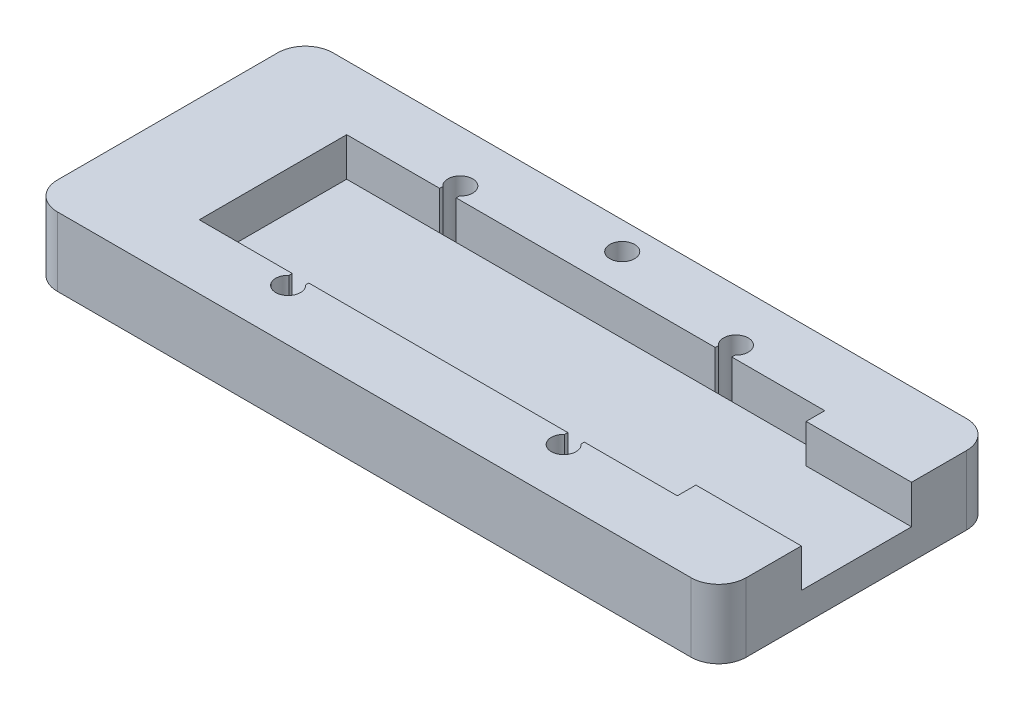
from build123d import *

# Parameters (mm, degrees)
EXTRUDE_1_DEPTH     = 5
CUT_EXTRUDE_1_DEPTH = 2.8
SKETCH_3_R          = 0.9
CUT_EXTRUDE_2_DEPTH = 5


with BuildPart() as part:
    # 草圖1 → 填料-伸長1 (new body)
    with BuildSketch(Plane(origin=(0, 0, 0), x_dir=(1, 0, 0), z_dir=(0, 1, 0))):
        with BuildLine():
            Line((-23, -10), (23, -10))
            ThreePointArc((23, -10), (24.414213562, -9.414213562), (25, -8))
            Line((25, -8), (25, 8))
            ThreePointArc((25, 8), (24.414213562, 9.414213562), (23, 10))
            Line((23, 10), (-23, 10))
            ThreePointArc((-23, 10), (-24.414213562, 9.414213562), (-25, 8))
            Line((-25, 8), (-25, -8))
            ThreePointArc((-25, -8), (-24.414213562, -9.414213562), (-23, -10))
        make_face()
    extrude(amount=EXTRUDE_1_DEPTH)

    # 草圖2 → 除料-伸長1 (cut)
    with BuildSketch(Plane(origin=(0, 5, 0), x_dir=(1, 0, 0), z_dir=(0, 1, 0))):
        Polygon((-17.35, -5.35), (17.35, -5.35), (17.35, -4), (25, -4), (25, 4), (17.35, 4), (17.35, 5.35), (-17.35, 5.35), align=None)
    extrude(amount=-CUT_EXTRUDE_1_DEPTH, mode=Mode.SUBTRACT)

    # 草圖3 → 除料-伸長2 (cut)
    with BuildSketch(Plane(origin=(0, 5, 0), x_dir=(1, 0, 0), z_dir=(0, 1, 0))):
        with Locations((0, 8)):
            Circle(SKETCH_3_R)
        with BuildLine():
            Line((-10.6, 5.579179607), (-10.6, 5.35))
            Line((-10.6, 5.35), (-9.4, 5.35))
            Line((-9.4, 5.35), (-9.4, 5.579179607))
            ThreePointArc((-9.4, 5.579179607), (-10, 7.15), (-10.6, 5.579179607))
        make_face()
        with BuildLine():
            Line((-10.6, -5.35), (-9.4, -5.35))
            Line((-9.4, -5.35), (-9.4, -5.579179607))
            ThreePointArc((-9.4, -5.579179607), (-10, -7.15), (-10.6, -5.579179607))
            Line((-10.6, -5.579179607), (-10.6, -5.35))
        make_face()
        with BuildLine():
            Line((10.6, 5.579179607), (10.6, 5.35))
            Line((10.6, 5.35), (9.4, 5.35))
            Line((9.4, 5.35), (9.4, 5.579179607))
            ThreePointArc((9.4, 5.579179607), (10, 7.15), (10.6, 5.579179607))
        make_face()
        with BuildLine():
            Line((9.4, -5.579179607), (9.4, -5.35))
            Line((9.4, -5.35), (10.6, -5.35))
            Line((10.6, -5.35), (10.6, -5.579179607))
            ThreePointArc((10.6, -5.579179607), (10, -7.15), (9.4, -5.579179607))
        make_face()
    extrude(amount=-CUT_EXTRUDE_2_DEPTH, mode=Mode.SUBTRACT)


solid = part.part
